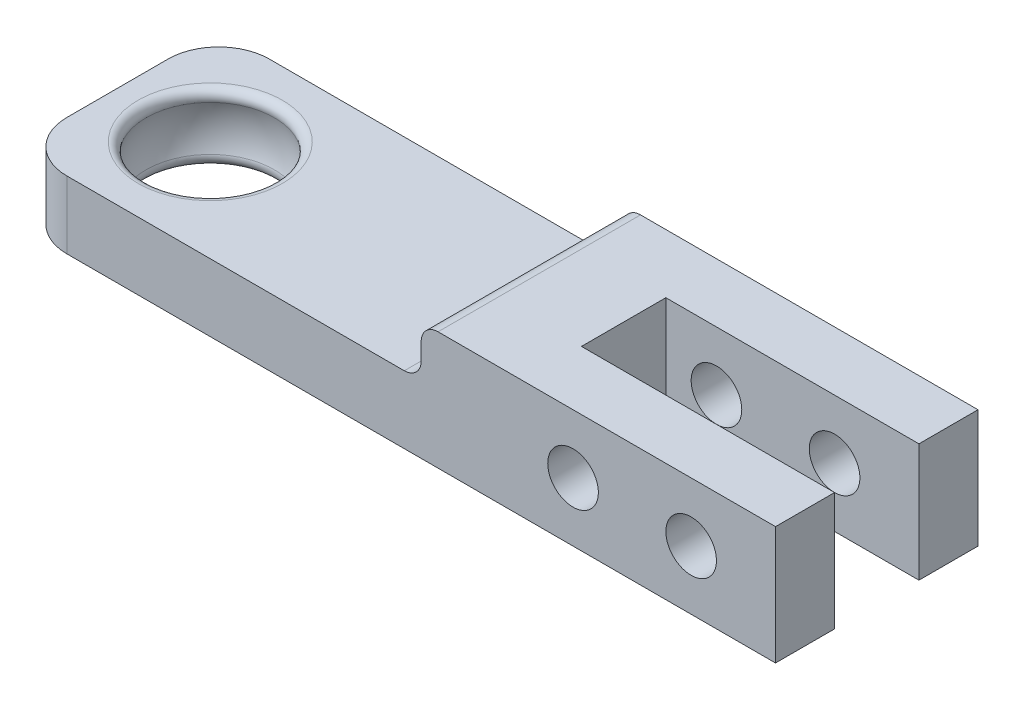
from build123d import *

# Parameters (mm, degrees)
SKETCH1_W               = 45
SKETCH1_H               = 12
BOSS_EXTRUDE1_DEPTH     = 2
FILLET1_R               = 3
FILLET15_R              = 0.5
CUT_EXTRUDE2_DEPTH      = 46.442271187
CUT_EXTRUDE2_DEPTH_BACK = 15
SKETCH11_W              = 5
SKETCH11_H              = 4
BOSS_EXTRUDE3_DEPTH     = 3
SKETCH14_R              = 1.5
CUT_EXTRUDE4_DEPTH      = 26.985573053
FILLET17_R              = 1


with BuildPart() as part:
    # Sketch1 → Boss-Extrude1 (new, symmetric)
    with BuildSketch(Plane(origin=(0, 0, 0), x_dir=(1, 0, 0), z_dir=(0, 1, 0))):
        Rectangle(SKETCH1_W, SKETCH1_H)
    extrude(amount=BOSS_EXTRUDE1_DEPTH, both=True)

    # Sketch2 → Cut-Revolve2 (revolve, cut)
    with BuildSketch(Plane.XY):
        with BuildLine():
            Line((-17, 2), (-17, -2))
            Line((-17, -2), (-20.5, -2))
            ThreePointArc((-20.5, -2), (-21.031128874, 0), (-20.5, 2))
            Line((-20.5, 2), (-17, 2))
        make_face()
    revolve(axis=Axis((-17, 2, 0), (0, -1, 0)), mode=Mode.SUBTRACT)

    # Fillet1
    fillet1_edges = [part.edges().sort_by_distance(p)[0] for p in [
        (-22.5, 0, -6),
        (-22.5, 0, 6),
    ]]
    fillet(fillet1_edges, radius=FILLET1_R)

    # Fillet15
    fillet15_edges = [part.edges().sort_by_distance(p)[0] for p in [
        (-13.5, 2, 0),
        (-13.5, -2, 0),
    ]]
    fillet(fillet15_edges, radius=FILLET15_R)

    # Sketch11 → Cut-Extrude2 (cut, two sides: drawn at the far end of the back side and taken through both)
    with BuildSketch(Plane(origin=(22.5, 0, 0), x_dir=(0, 0, -1), z_dir=(1, 0, 0)).offset(-CUT_EXTRUDE2_DEPTH_BACK)):
        Rectangle(SKETCH11_W, SKETCH11_H)
    extrude(amount=CUT_EXTRUDE2_DEPTH + CUT_EXTRUDE2_DEPTH_BACK, mode=Mode.SUBTRACT)

    # Sketch13 → Boss-Extrude3 (add)
    with BuildSketch(Plane(origin=(0, 2, 0), x_dir=(1, 0, 0), z_dir=(0, 1, 0))):
        Polygon((22.5, 2.5), (7.5, 2.5), (7.5, -2.5), (22.5, -2.5), (22.5, -6), (1.5, -6), (1.5, -2.5), (1.5, 2.5), (1.5, 6), (22.5, 6), align=None)
    extrude(amount=BOSS_EXTRUDE3_DEPTH)

    # Sketch14 → Cut-Extrude4 (cut, through all)
    with BuildSketch(Plane(origin=(0, 0, -6), x_dir=(-1, 0, 0), z_dir=(0, 0, -1))):
        with Locations((-17.5, 1.5)):
            Circle(SKETCH14_R)
        with Locations((-10.5, 1.5)):
            Circle(SKETCH14_R)
    extrude(amount=-CUT_EXTRUDE4_DEPTH, mode=Mode.SUBTRACT)

    # Fillet17
    fillet17_edges = [part.edges().sort_by_distance(p)[0] for p in [
        (1.5, 2, 0),
        (1.5, 5, 0),
    ]]
    fillet(fillet17_edges, radius=FILLET17_R)


solid = part.part
